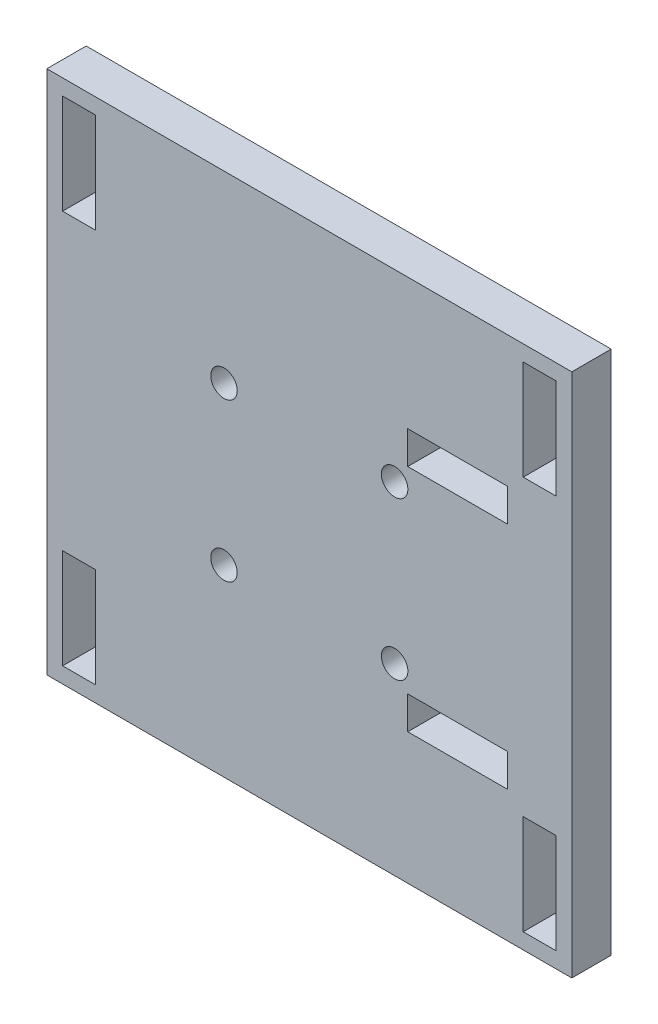
from build123d import *

# Parameters (mm, degrees)
SKETCH1_W           = 40
SKETCH1_H           = 40
SKETCH1_R           = 1.01
BOSS_EXTRUDE1_DEPTH = 3
SKETCH2_W           = 2.5
SKETCH2_H           = 7.6
SKETCH2_W_2         = 7.6
SKETCH2_H_2         = 2.5
CUT_EXTRUDE1_DEPTH  = 29.442925307


with BuildPart() as part:
    # Sketch1 → Boss-Extrude1 (new body)
    with BuildSketch(Plane.XY):
        Rectangle(SKETCH1_W, SKETCH1_H)
        with Locations((6.5, -6)):
            Circle(SKETCH1_R, mode=Mode.SUBTRACT)
        with Locations((-6.5, -6)):
            Circle(SKETCH1_R, mode=Mode.SUBTRACT)
        with Locations((6.5, 6)):
            Circle(SKETCH1_R, mode=Mode.SUBTRACT)
        with Locations((-6.5, 6)):
            Circle(SKETCH1_R, mode=Mode.SUBTRACT)
    extrude(amount=BOSS_EXTRUDE1_DEPTH)

    # Sketch2 → Cut-Extrude1 (cut, through all)
    with BuildSketch(Plane.XY.offset(3)):
        with Locations((17.55, 15)):
            Rectangle(SKETCH2_W, SKETCH2_H)
        with Locations((-17.55, 15)):
            Rectangle(SKETCH2_W, SKETCH2_H)
        with Locations((11.3, 8.75)):
            Rectangle(SKETCH2_W_2, SKETCH2_H_2)
        with Locations((17.55, -15)):
            Rectangle(SKETCH2_W, SKETCH2_H)
        with Locations((-17.55, -15)):
            Rectangle(SKETCH2_W, SKETCH2_H)
        with Locations((11.3, -8.75)):
            Rectangle(SKETCH2_W_2, SKETCH2_H_2)
    extrude(amount=-CUT_EXTRUDE1_DEPTH, mode=Mode.SUBTRACT)


solid = part.part
